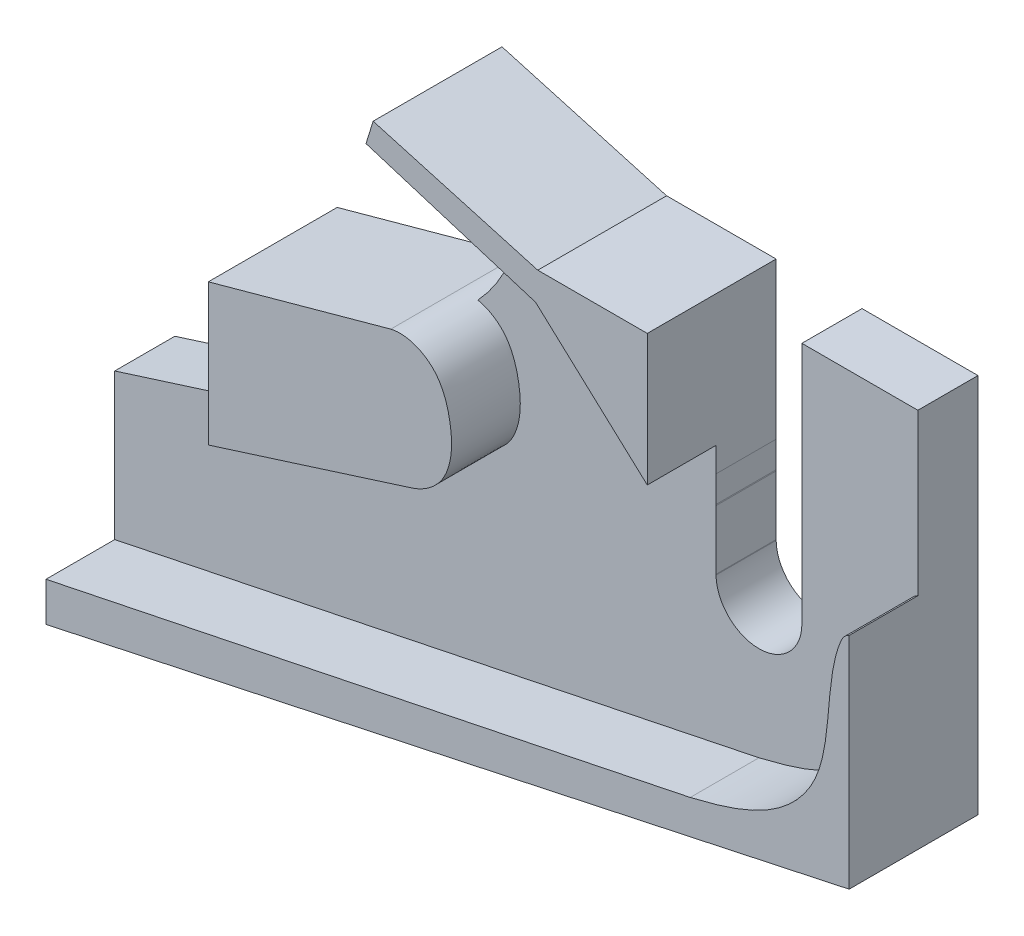
from build123d import *

# Parameters (mm, degrees)
BOSS_EXTRUDE1_DEPTH = 7
BOSS_EXTRUDE3_DEPTH = 15


# Read off the part's stored shape, not the designer's step: Boss-Extrude1
with BuildPart() as part:
    # Boss-Extrude1 outline → Boss-Extrude1 (new body)
    with BuildSketch(Plane.XY):
        with BuildLine():
            add(Edge.make_bspline(
                [(83.179707937, 167.890249892), (88.68617922, 173.842337038), (88.076413708, 182.068482243)],
                knots=[0, 0, 0, 1, 1, 1], degree=2))
            add(Edge.make_bspline(
                [(83.179707937, 167.890249892), (82.472579462, 168.045621317), (81.739782997, 168.056822807), (81.038915385, 167.890249892)],
                knots=[0.899910496, 0.899910496, 0.899910496, 0.899910496, 1, 1, 1, 1], degree=3))
            Line((81.038915385, 167.890249892), (59.792534645, 162.03653789))
            Line((59.792534645, 162.03653789), (59.792534645, 145.583851284))
            Line((59.792534645, 145.583851284), (40.895456025, 139.599456998))
            Line((40.895456025, 139.599456998), (40.895456025, 118.042870489))
            Line((40.895456025, 118.042870489), (134.396295865, 138.100245442))
            Line((134.396295865, 138.100245442), (134.393693517, 182.387043765))
            Line((134.393693517, 182.387043765), (120.894388682, 182.386250529))
            Line((120.894388682, 182.386250529), (120.894655408, 177.847108131))
            Line((120.894655408, 177.847108131), (120.895456025, 177.847108131))
            Line((120.895456025, 177.847108131), (120.895456025, 154.100245399))
            ThreePointArc((120.895456025, 154.100245399), (115.9356337, 149.100406826), (110.896101724, 154.019892645))
            Line((110.896101724, 154.019892645), (110.896055334, 154.022832661))
            ThreePointArc((110.896055334, 154.022832661), (110.895605855, 154.06153787), (110.895456025, 154.100245399))
            Line((110.895456025, 154.100245399), (110.895456025, 161.015247015))
            ThreePointArc((110.895456025, 161.015247015), (110.895045928, 161.07928452), (110.895456025, 161.143322025))
            Line((110.895456025, 161.143322025), (110.895456025, 164.221886849))
            Line((110.895456025, 164.221886849), (110.894388699, 182.385662916))
            Line((110.894388699, 182.385662916), (98.145136748, 182.384913754))
            Line((98.145136748, 182.384913754), (78.980988049, 187.822713754))
            Line((78.980988049, 187.822713754), (78.151089215, 185.147538204))
            Line((78.151089215, 185.147538204), (88.076413708, 182.068482243))
        make_face()
    extrude(amount=BOSS_EXTRUDE1_DEPTH)

    # Sketch2<5> → Boss-Extrude3 (add)
    with BuildSketch(Plane.XY):
        Polygon((87.058497999, 182.38426229), (98.145136748, 182.384913754), (78.980988049, 187.822713754), (78.151089215, 185.147538204), align=None)
        Polygon((97.8963446, 179.022069051), (110.895286898, 167.10010673), (110.895184282, 168.846419808), (110.894388699, 182.385662916), (98.145136748, 182.384913754), (87.058497999, 182.38426229), (88.076413708, 182.068482243), align=None)
        with BuildLine():
            add(Edge.make_bspline(
                [(83.134894854, 152.985445474), (84.153265888, 153.250657791), (85.549452344, 153.989195137), (87.192525807, 155.758725734), (88.24110083, 158.391839128), (88.095392567, 162.20289978), (86.73683171, 166.246070864), (84.288905188, 167.646535258), (83.179707937, 167.890249892)],
                knots=[0, 0, 0, 0, 0.147705893, 0.214614821, 0.335693148, 0.532502628, 0.742910733, 0.899910496, 0.899910496, 0.899910496, 0.899910496], degree=3))
            add(Edge.make_bspline(
                [(83.179707937, 167.890249892), (82.472579462, 168.045621317), (81.739782997, 168.056822807), (81.038915385, 167.890249892)],
                knots=[0.899910496, 0.899910496, 0.899910496, 0.899910496, 1, 1, 1, 1], degree=3))
            Line((81.038915385, 167.890249892), (59.792534645, 162.03653789))
            Line((59.792534645, 162.03653789), (59.792534645, 145.583851284))
            Line((59.792534645, 145.583851284), (70.8963446, 149.100245442))
            Line((70.8963446, 149.100245442), (83.134894854, 152.985445474))
        make_face()
        with BuildLine():
            Line((134.396295865, 138.100245442), (134.394792427, 163.685781747))
            add(Edge.make_bspline(
                [(133.42138155, 162.598444875), (133.72729857, 163.386688135), (134.394792427, 163.685781747)],
                knots=[0, 0, 0, 0.668506509, 0.668506509, 0.668506509], degree=2))
            add(Edge.make_bspline(
                [(115.8963446, 138.100245442), (119.177270844, 138.889647711), (125.41355503, 140.587971019), (133.049150273, 149.2867081), (131.448441996, 157.912006128), (133.42138155, 162.598444875)],
                knots=[0, 0, 0, 0, 0.334742766, 0.521400868, 1, 1, 1, 1], degree=3))
            Line((115.8963446, 138.100245442), (40.895456025, 122.599456998))
            Line((40.895456025, 122.599456998), (40.895456025, 118.042870489))
            Line((40.895456025, 118.042870489), (134.396295865, 138.100245442))
        make_face()
    extrude(amount=BOSS_EXTRUDE3_DEPTH)


solid = part.part
